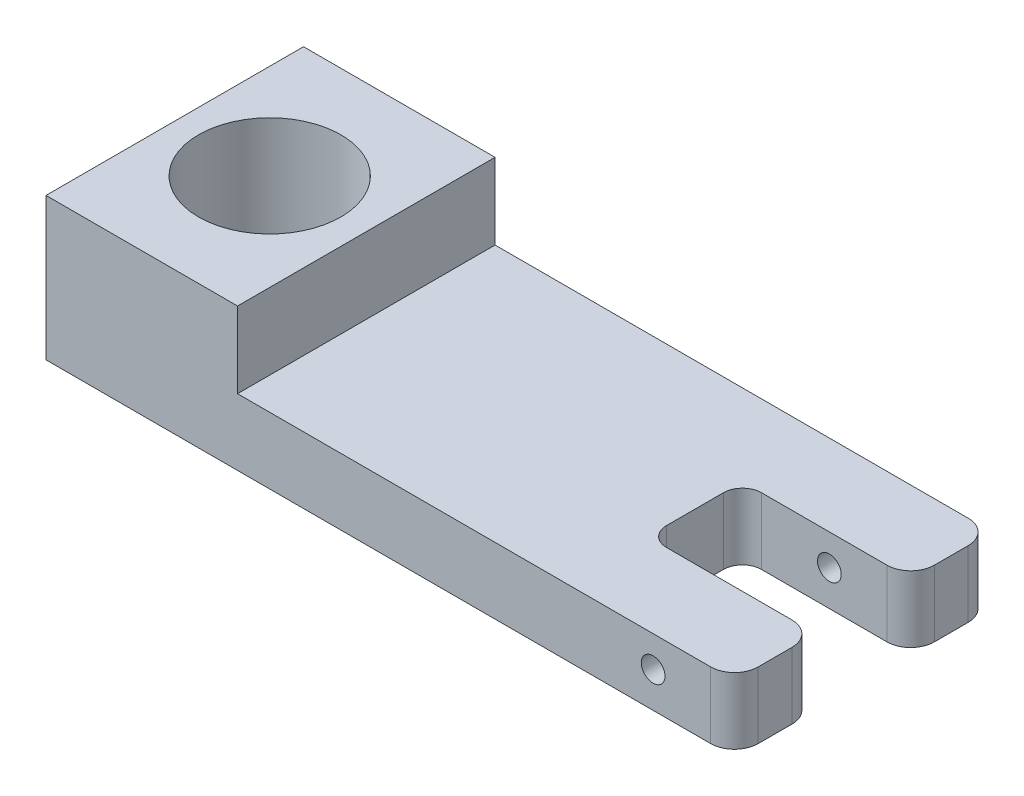
from build123d import *

# Parameters (mm, degrees)
SKETCH_1_W          = 145
SKETCH_1_H          = 54.239140964
SKETCH_1_R          = 15
EXTRUDE_1_DEPTH     = 14
CUT_EXTRUDE_1_DEPTH = 50
FILLET_2_R          = 5
SKETCH_3_R          = 2.5
CUT_EXTRUDE_2_DEPTH = 36
SKETCH_4_W          = 40.34248958
SKETCH_4_H          = 54.239140964
SKETCH_4_R          = 15
EXTRUDE_2_DEPTH     = 16


with BuildPart() as part:
    # Эскиз1 → Вытянуть1 (new body)
    with BuildSketch(Plane(origin=(0, 0, 0), x_dir=(1, 0, 0), z_dir=(0, 1, 0))):
        with Locations((52.5, 0)):
            Rectangle(SKETCH_1_W, SKETCH_1_H)
        Circle(SKETCH_1_R, mode=Mode.SUBTRACT)
    extrude(amount=EXTRUDE_1_DEPTH)

    # Эскиз2 → Вырез-Вытянуть1 (cut)
    with BuildSketch(Plane(origin=(0, 0, 0), x_dir=(1, 0, 0), z_dir=(0, 1, 0))):
        with BuildLine():
            Line((93.569014329, -10), (130.542559867, -10))
            Line((130.542559867, -10), (130.542559867, 10))
            Line((130.542559867, 10), (93.573862666, 10))
            ThreePointArc((93.573862666, 10), (90.74600698, 8.828998449), (89.573862992, 6.001616112))
            Line((89.573862992, 6.001616112), (89.569014656, -5.998383888))
            ThreePointArc((89.569014656, -5.998383888), (90.74001588, -8.827855685), (93.569014329, -10))
        make_face()
    extrude(amount=CUT_EXTRUDE_1_DEPTH, mode=Mode.SUBTRACT)

    # Скругление2
    fillet_2_edges = [part.edges().sort_by_distance(p)[0] for p in [
        (125, 7, 10),
        (125, 7, -10),
        (125, 7, -27.119570482),
        (125, 7, 27.119570482),
    ]]
    fillet(fillet_2_edges, radius=FILLET_2_R)

    # Эскиз3 → Вырез-Вытянуть2 (cut, symmetric)
    with BuildSketch(Plane.XY):
        with Locations((107.871367235, 7.461129595)):
            Circle(SKETCH_3_R)
    extrude(amount=CUT_EXTRUDE_2_DEPTH, both=True, mode=Mode.SUBTRACT)

    # Эскиз4 → Вытянуть2 (add)
    with BuildSketch(Plane(origin=(0, 14, 0), x_dir=(1, 0, 0), z_dir=(0, 1, 0))):
        with Locations((0.17124479, 0)):
            Rectangle(SKETCH_4_W, SKETCH_4_H)
        Circle(SKETCH_4_R, mode=Mode.SUBTRACT)
    extrude(amount=EXTRUDE_2_DEPTH)


solid = part.part
